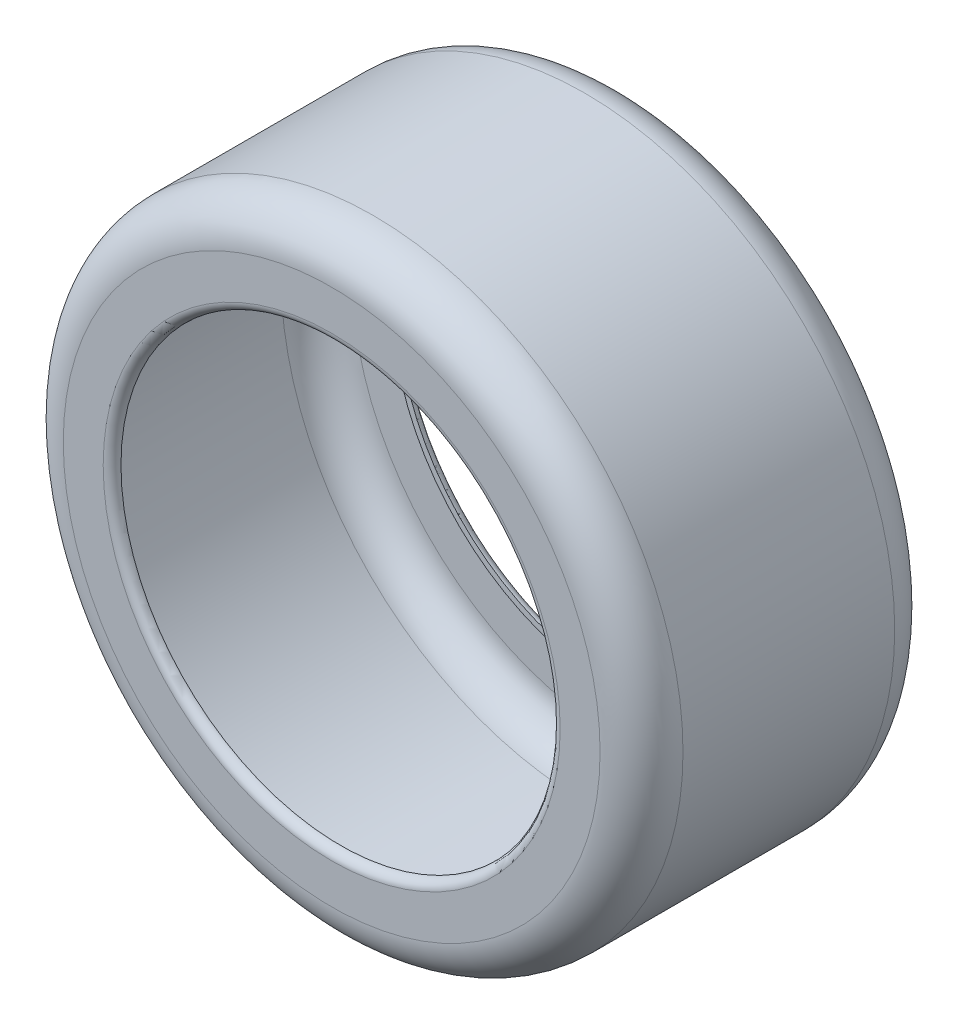
from build123d import *

# Parameters (mm, degrees)
SKETCH1_R           = 261.62
SKETCH1_R_2         = 185.42
EXTRUDE_THIN1_DEPTH = 124.38
FILLET1_R           = 35
FILLET2_R           = 7.5


# Read off the part's stored shape, not the designer's step: Shell1
with BuildPart() as part:
    # Sketch1 → Extrude-Thin1 (new, symmetric)
    with BuildSketch(Plane.XY):
        Circle(SKETCH1_R)
        Circle(SKETCH1_R_2, mode=Mode.SUBTRACT)
    extrude(amount=EXTRUDE_THIN1_DEPTH, both=True)

    # Fillet1
    fillet1_edges = [part.edges().sort_by_distance(p)[0] for p in [
        (-261.62, 0, -124.38),
        (-261.62, 0, 124.38),
    ]]
    fillet(fillet1_edges, radius=FILLET1_R)

    # Fillet2
    fillet2_edges = [part.edges().sort_by_distance(p)[0] for p in [
        (-185.42, 0, -124.38),
        (-185.42, 0, 124.38),
    ]]
    fillet(fillet2_edges, radius=FILLET2_R)

    # Shell1 outline → Shell1 (revolve, cut)
    with BuildSketch(Plane.XZ):
        with BuildLine():
            Line((190.42, 116.88), (185.42, 116.88))
            Line((185.42, 116.88), (185.42, -116.88))
            Line((185.42, -116.88), (190.42, -116.88))
            ThreePointArc((190.42, -116.88), (191.152233047, -118.647766953), (192.92, -119.38))
            Line((192.92, -119.38), (226.62, -119.38))
            ThreePointArc((226.62, -119.38), (247.833203436, -110.593203436), (256.62, -89.38))
            Line((256.62, -89.38), (256.62, 89.38))
            ThreePointArc((256.62, 89.38), (247.833203436, 110.593203436), (226.62, 119.38))
            Line((226.62, 119.38), (192.92, 119.38))
            ThreePointArc((192.92, 119.38), (191.152233047, 118.647766953), (190.42, 116.88))
        make_face()
    revolve(axis=Axis((0, 0, 0), (0, 0, 1)), mode=Mode.SUBTRACT)


solid = part.part
